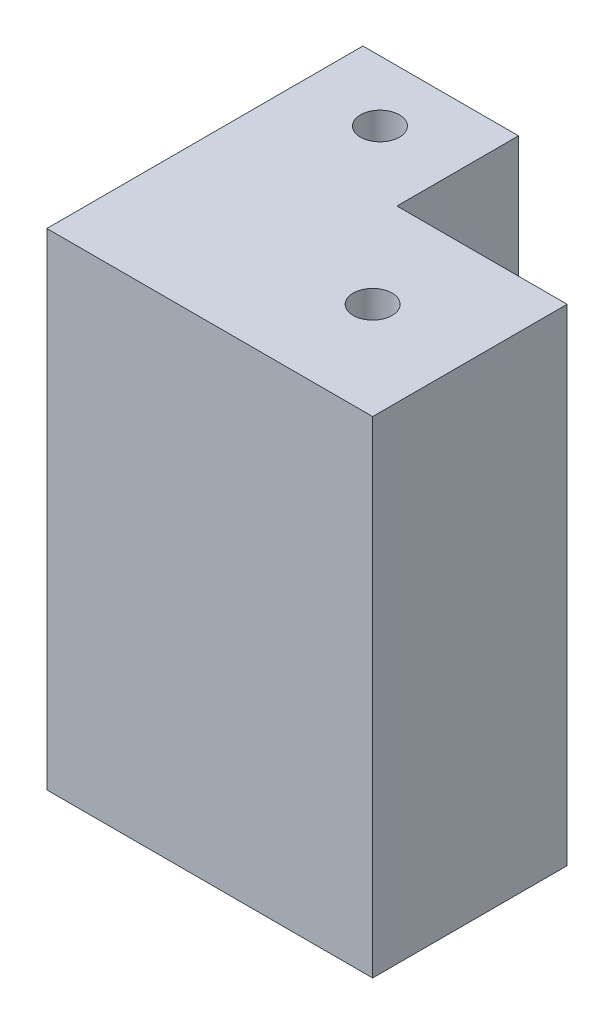
from build123d import *

# Parameters (mm, degrees)
SKETCH1_R                               = 4
BOSS_EXTRUDE1_DEPTH                     = 100
CBORE_FOR_M5_HEX_HEAD_BOLT2_D           = 13.5
CBORE_FOR_M5_HEX_HEAD_BOLT2_DEPTH       = 23.85
CBORE_FOR_M5_HEX_HEAD_BOLT2_CBORE_D     = 32
CBORE_FOR_M5_HEX_HEAD_BOLT2_CBORE_DEPTH = 5
CBORE_FOR_M5_HEX_HEAD_BOLT3_D           = 10.2
CBORE_FOR_M5_HEX_HEAD_BOLT3_DEPTH       = 13.5
CBORE_FOR_M5_HEX_HEAD_BOLT3_CBORE_D     = 22
CBORE_FOR_M5_HEX_HEAD_BOLT3_CBORE_DEPTH = 3.5


with BuildPart() as part:
    # Sketch1 → Boss-Extrude1 (new body)
    with BuildSketch(Plane(origin=(0, 0, 0), x_dir=(1, 0, 0), z_dir=(0, 1, 0))):
        Polygon((0, 0), (0, 25), (-32, 25), (-32, -40), (35, -40), (35, 0), align=None)
        with Locations((-16, 12.5)):
            Circle(SKETCH1_R, mode=Mode.SUBTRACT)
        with Locations((15, -20)):
            Circle(SKETCH1_R, mode=Mode.SUBTRACT)
    extrude(amount=BOSS_EXTRUDE1_DEPTH)

    # CBORE for M5 Hex Head Bolt2
    with Locations(Plane(origin=(0, 0, 0), x_dir=(-1, 0, 0), z_dir=(0, -1, 0))):
        with Locations((-15, -20)):
            CounterBoreHole(CBORE_FOR_M5_HEX_HEAD_BOLT2_D / 2, CBORE_FOR_M5_HEX_HEAD_BOLT2_CBORE_D / 2, CBORE_FOR_M5_HEX_HEAD_BOLT2_CBORE_DEPTH, depth=CBORE_FOR_M5_HEX_HEAD_BOLT2_DEPTH)

    # CBORE for M5 Hex Head Bolt3
    with Locations(Plane(origin=(0, 0, 0), x_dir=(-1, 0, 0), z_dir=(0, -1, 0))):
        with Locations((16, 12.5)):
            CounterBoreHole(CBORE_FOR_M5_HEX_HEAD_BOLT3_D / 2, CBORE_FOR_M5_HEX_HEAD_BOLT3_CBORE_D / 2, CBORE_FOR_M5_HEX_HEAD_BOLT3_CBORE_DEPTH, depth=CBORE_FOR_M5_HEX_HEAD_BOLT3_DEPTH)


solid = part.part
